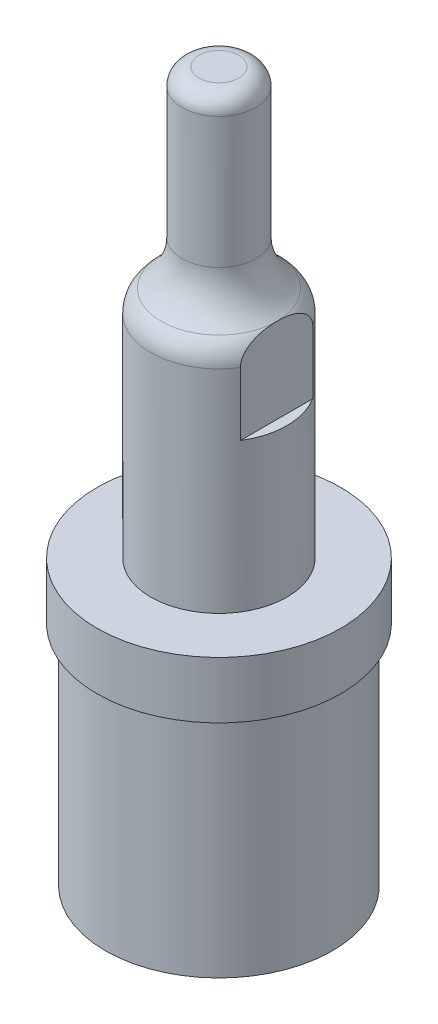
from build123d import *

# Parameters (mm, degrees)
SKETCH1_R               = 20
BOSS_EXTRUDE1_DEPTH     = 40
SKETCH2_R               = 21.5
BOSS_EXTRUDE2_DEPTH     = 10
SKETCH3_R               = 6.5
BOSS_EXTRUDE3_DEPTH     = 75
SKETCH4_R               = 12
BOSS_EXTRUDE4_DEPTH     = 40
FILLET1_R               = 10
FILLET2_R               = 5
FILLET3_R               = 3
SKETCH5_R               = 4
BOSS_EXTRUDE5_DEPTH     = 5
CUT_EXTRUDE1_DEPTH      = 129.64486008
CUT_EXTRUDE1_DEPTH_BACK = 129.64486008
SKETCH6_W               = 1.833333333
SKETCH6_H               = 15


with BuildPart() as part:
    # Sketch1 → Boss-Extrude1 (new body)
    with BuildSketch(Plane(origin=(0, 0, 0), x_dir=(1, 0, 0), z_dir=(0, 1, 0))):
        with Locations(Location((0, 0, 0), (0, 0, 270))):
            Circle(SKETCH1_R)
    extrude(amount=BOSS_EXTRUDE1_DEPTH)

    # Sketch2 → Boss-Extrude2 (add)
    with BuildSketch(Plane(origin=(0, 40, 0), x_dir=(1, 0, 0), z_dir=(0, 1, 0))):
        with Locations(Location((0, 0, 0), (0, 0, 270))):
            Circle(SKETCH2_R)
    extrude(amount=BOSS_EXTRUDE2_DEPTH)

    # Sketch3 → Boss-Extrude3 (add)
    with BuildSketch(Plane(origin=(0, 50, 0), x_dir=(1, 0, 0), z_dir=(0, 1, 0))):
        with Locations(Location((0, 0, 0), (0, 0, 270))):
            Circle(SKETCH3_R)
    extrude(amount=BOSS_EXTRUDE3_DEPTH)

    # Sketch4 → Boss-Extrude4 (add)
    with BuildSketch(Plane(origin=(0, 50, 0), x_dir=(1, 0, 0), z_dir=(0, 1, 0))):
        with Locations(Location((0, 0, 0), (0, 0, 270))):
            Circle(SKETCH4_R)
    extrude(amount=BOSS_EXTRUDE4_DEPTH)

    # Fillet1
    # the kernel refuses this fillet: 10 mm, written as the material it adds along each edge
    with BuildSketch(Plane(origin=(0, 90, 0), x_dir=(0, 0, 1), z_dir=(1, 0, 0))) as fillet1_piece_1:
        with BuildLine():
            CenterArc((16.5, -8.93028555), FILLET1_R, 116.74368395, 63.25631605)
            Line((6.5, -8.93028555), (6.3, -8.93028555))
            Line((6.3, -8.93028555), (6.3, 0))
            Line((6.3, 0), (6.5, 0.2))
            ThreePointArc((6.5, 0.2), (9.25, 0.2), (11.91, 0.178605711))
            Line((11.91, 0.178605711), (12, 0))
        make_face()
    revolve(axis=Axis((0, 90, 0), (0, -1, 0)))

    # Fillet2
    fillet2_edges = [part.edges().sort_by_distance(p)[0] for p in [
        (0, 90, -12),
    ]]
    fillet(fillet2_edges, radius=FILLET2_R)

    # Fillet3
    fillet3_edges = [part.edges().sort_by_distance(p)[0] for p in [
        (0, 125, -6.5),
    ]]
    fillet(fillet3_edges, radius=FILLET3_R)

    # Sketch5 → Boss-Extrude5 (add)
    with BuildSketch(Plane.XZ):
        with Locations(Location((0, 0, 0), (0, 0, 270))):
            Circle(SKETCH5_R)
    extrude(amount=BOSS_EXTRUDE5_DEPTH)

    # Sketch6 → Cut-Extrude1 (cut, two sides: drawn at the far end of the back side and taken through both)
    with BuildSketch(Plane.XY.offset(-CUT_EXTRUDE1_DEPTH_BACK)):
        with Locations((-11.083333334, 83.691494372)):
            Rectangle(SKETCH6_W, SKETCH6_H)
        with Locations((11.083333334, 83.691494372)):
            Rectangle(SKETCH6_W, SKETCH6_H)
    extrude(amount=CUT_EXTRUDE1_DEPTH + CUT_EXTRUDE1_DEPTH_BACK, mode=Mode.SUBTRACT)


solid = part.part
